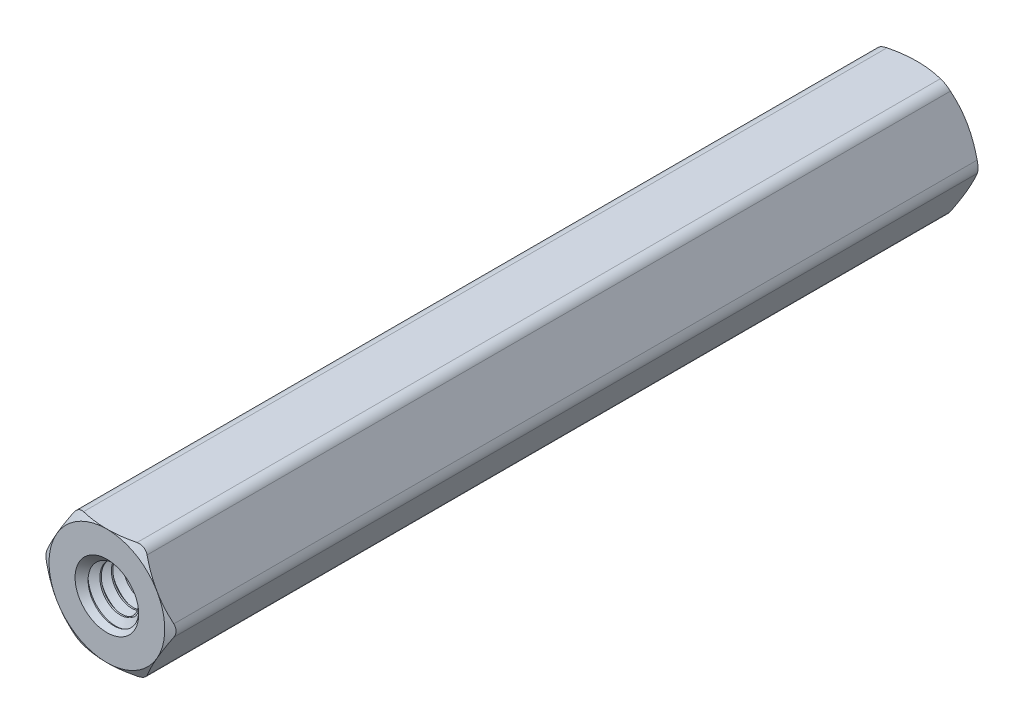
from build123d import *

# Parameters (mm, degrees)
SKETCH4_R           = 4.7625
BOSS_EXTRUDE1_DEPTH = 44.45
SKETCH5_OUTSIDE_W   = 348.112
SKETCH5_OUTSIDE_H   = 346.148
SKETCH5_OUTSIDE_R   = 6.35
CUT_EXTRUDE1_DEPTH  = 90.427601071
CUT_EXTRUDE1_DRAFT  = -60
SKETCH6_OUTSIDE_W   = 348.112
SKETCH6_OUTSIDE_H   = 346.148
SKETCH6_OUTSIDE_R   = 6.35
CUT_EXTRUDE2_DEPTH  = 90.427601071
CUT_EXTRUDE2_DRAFT  = -60
FILLET1_R           = 1.27
BOSS_EXTRUDE2_START = -15.875
SKETCH7_R           = 3.4925
BOSS_EXTRUDE2_DEPTH = 15.875
SKETCH8_W           = 15.875
SKETCH8_H           = 3.175
CUT_SWEEP1_PITCH    = 1.27
CIRPATTERN1_COUNT   = 2


with BuildPart() as part:
    # Sketch3 → Revolve1 (revolve)
    with BuildSketch(Plane(origin=(0, 0, 0), x_dir=(0, 0, -1), z_dir=(1, 0, 0))):
        Polygon((-44.1325, 3.175), (-28.575, 3.175), (-28.575, 0), (28.575, 0), (28.575, 3.175), (44.45, 3.175), (44.45, 6.35), (0, 6.35), (-44.45, 6.35), (-44.45, 3.4925), align=None)
        Polygon((-44.1325, 3.175), (-28.575, 3.175), (-28.575, 0), (28.575, 0), (28.575, 3.175), (44.45, 3.175), (44.45, 6.35), (0, 6.35), (-44.45, 6.35), (-44.45, 3.4925), align=None)
    revolve(axis=Axis((0, 0, 28.575), (0, 0, 1)))

    # Sketch4 → Boss-Extrude1 (add, symmetric)
    with BuildSketch(Plane.XY):
        Polygon((-3.666174209, 6.35), (-7.332348419, 0), (-3.666174209, -6.35), (3.666174209, -6.35), (7.332348419, 0), (3.666174209, 6.35), align=None)
        Circle(SKETCH4_R, mode=Mode.SUBTRACT)
    extrude(amount=BOSS_EXTRUDE1_DEPTH, both=True)


with BuildPart() as cut_extrude1_tool:
    # Sketch5 outside → Cut-Extrude1 (with draft: the straight prism first)
    with BuildSketch(Plane.XY.offset(44.45)):
        Rectangle(SKETCH5_OUTSIDE_W, SKETCH5_OUTSIDE_H)
        Circle(SKETCH5_OUTSIDE_R, mode=Mode.SUBTRACT)
    extrude(amount=-CUT_EXTRUDE1_DEPTH)
    # Cut-Extrude1: the draft: its side faces are tilted about the plane it starts from
    cut_extrude1_sides = [cut_extrude1_tool.faces().sort_by_distance(p)[0] for p in [
        (0, -173.074, -0.763800536),
        (174.056, 0, -0.763800536),
        (0, 173.074, -0.763800536),
        (-174.056, 0, -0.763800536),
        (-6.35, 0, -0.763800536),
    ]]
    draft(cut_extrude1_sides, Plane.XY.offset(44.45), CUT_EXTRUDE1_DRAFT)


with BuildPart() as part_1:
    add(part.part)

    # Cut-Extrude1: cut by cut_extrude1_tool
    add(cut_extrude1_tool.part, mode=Mode.SUBTRACT)


with BuildPart() as cut_extrude2_tool:
    # Sketch6 outside → Cut-Extrude2 (with draft: the straight prism first)
    with BuildSketch(Plane(origin=(0, 0, -44.45), x_dir=(-1, 0, 0), z_dir=(0, 0, -1))):
        Rectangle(SKETCH6_OUTSIDE_W, SKETCH6_OUTSIDE_H)
        Circle(SKETCH6_OUTSIDE_R, mode=Mode.SUBTRACT)
    extrude(amount=-CUT_EXTRUDE2_DEPTH)
    # Cut-Extrude2: the draft: its side faces are tilted about the plane it starts from
    cut_extrude2_sides = [cut_extrude2_tool.faces().sort_by_distance(p)[0] for p in [
        (0, -173.074, 0.763800536),
        (-174.056, 0, 0.763800536),
        (0, 173.074, 0.763800536),
        (174.056, 0, 0.763800536),
        (6.35, 0, 0.763800536),
    ]]
    draft(cut_extrude2_sides, Plane(origin=(0, 0, -44.45), x_dir=(-1, 0, 0), z_dir=(0, 0, -1)), CUT_EXTRUDE2_DRAFT)


with BuildPart() as part_2:
    add(part_1.part)

    # Cut-Extrude2: cut by cut_extrude2_tool
    add(cut_extrude2_tool.part, mode=Mode.SUBTRACT)

    # Fillet1
    fillet1_edges = [part_2.edges().sort_by_distance(p)[0] for p in [
        (3.666174209, 6.35, 0),
        (-7.332348419, 0, 0),
        (-3.666174209, -6.35, 0),
        (3.666174209, -6.35, 0),
        (7.332348419, 0, 0),
        (-3.666174209, 6.35, 0),
    ]]
    fillet(fillet1_edges, radius=FILLET1_R)

    # Split1
    split(bisect_by=Plane.XY, keep=Keep.TOP)

    # Sketch7 → Boss-Extrude2 (add)
    with BuildSketch(Plane(origin=(0, 0, 28.575), x_dir=(-1, 0, 0), z_dir=(0, 0, -1)).offset(BOSS_EXTRUDE2_START)):
        Circle(SKETCH7_R)
    extrude(amount=BOSS_EXTRUDE2_DEPTH)


with BuildPart() as body_2:
    # Sketch8 → Revolve2 (revolve)
    with BuildSketch(Plane(origin=(0, 0, 0), x_dir=(0, 0, -1), z_dir=(1, 0, 0))):
        with Locations((-36.5125, 1.5875)):
            Rectangle(SKETCH8_W, SKETCH8_H)
    revolve(axis=Axis((0, 0, 28.575), (0, 0, 1)))

    # Cut-Sweep1: the profile of Sketch10 screwed along a right-hand helix of 13.5 turns, 8 arcs to a turn; built about Z, then put on its axis
    cut_sweep1_z = Axis((0, 0, 0), (0, 0, 1))
    cut_sweep1_corners = [(2.350110803, 0, -0.635), (2.350110803, 0, -0.47625), (3.243740766, 0, 0.0396875), (3.243740766, 0, -1.1509375)]
    with BuildLine(mode=Mode.PRIVATE) as cut_sweep1_profile:
        Line(cut_sweep1_corners[0], cut_sweep1_corners[1])
        Line(cut_sweep1_corners[1], cut_sweep1_corners[2])
        Line(cut_sweep1_corners[2], cut_sweep1_corners[3])
        Line(cut_sweep1_corners[3], cut_sweep1_corners[0])
    cut_sweep1_cap = Face(cut_sweep1_profile.wire())
    cut_sweep1_turn_angles = [0, 22.5, 45, 67.5, 90, 112.5, 135, 157.5, 180, 202.5, 225, 247.5, 270, 292.5, 315, 337.5, 360]
    cut_sweep1_turn_weights = [1, 0.9238795325112867, 1, 0.9238795325112867, 1, 0.9238795325112867, 1, 0.9238795325112867, 1, 0.9238795325112867, 1, 0.9238795325112867, 1, 0.9238795325112867, 1, 0.9238795325112867, 1]
    cut_sweep1_turn_rails = [Edge.make_bspline([Vector(p[0], p[1], 0).rotate(cut_sweep1_z, cut_sweep1_turn_angles[k]) / cut_sweep1_turn_weights[k] + Vector(0, 0, p[2] + CUT_SWEEP1_PITCH * cut_sweep1_turn_angles[k] / 360) for k in range(17)], [0, 0, 0, 1, 1, 2, 2, 3, 3, 4, 4, 5, 5, 6, 6, 7, 7, 8, 8, 8], 2, cut_sweep1_turn_weights) for p in cut_sweep1_corners]
    cut_sweep1_turn_sides = [Face.make_surface_from_curves(cut_sweep1_turn_rails[p[0]], cut_sweep1_turn_rails[p[1]]) for p in [(0, 1), (1, 2), (2, 3), (3, 0)]]
    cut_sweep1_last_angles = [4680, 4702.5, 4725, 4747.5, 4770, 4792.5, 4815, 4837.5, 4860]
    cut_sweep1_last_weights = [1, 0.9238795325112867, 1, 0.9238795325112867, 1, 0.9238795325112867, 1, 0.9238795325112078, 1]
    cut_sweep1_last_rails = [Edge.make_bspline([Vector(p[0], p[1], 0).rotate(cut_sweep1_z, cut_sweep1_last_angles[k]) / cut_sweep1_last_weights[k] + Vector(0, 0, p[2] + CUT_SWEEP1_PITCH * cut_sweep1_last_angles[k] / 360) for k in range(9)], [0, 0, 0, 1, 1, 2, 2, 3, 3, 4, 4, 4], 2, cut_sweep1_last_weights) for p in cut_sweep1_corners]
    cut_sweep1_last_sides = [Face.make_surface_from_curves(cut_sweep1_last_rails[p[0]], cut_sweep1_last_rails[p[1]]) for p in [(0, 1), (1, 2), (2, 3), (3, 0)]]
    cut_sweep1 = Plane(origin=(0, 0, 44.45), x_dir=(0, 1, 0), z_dir=(0, 0, -1)) * Solid(Shell([*[p.moved(Location((0, 0, CUT_SWEEP1_PITCH * i))) for i in range(13) for p in cut_sweep1_turn_sides], *cut_sweep1_last_sides, cut_sweep1_cap, cut_sweep1_cap.rotate(cut_sweep1_z, 4860).moved(Location((0, 0, CUT_SWEEP1_PITCH * 4860 / 360)))]))
    add(cut_sweep1, mode=Mode.SUBTRACT)


with BuildPart() as part_3:
    add(part_2.part)

    # Combine1: cut body 2
    add(body_2.part, mode=Mode.SUBTRACT)

    # Cut-Extrude3 cone 1 section (through the dimple's axis) → Cut-Extrude3 (revolve, cut)
    with BuildSketch(Plane(origin=(0, 0, 44.45), x_dir=(0, -1, 0), z_dir=(1, 0, 0))):
        Polygon((0, 0), (3.4925, 0), (0, 3.4925), align=None)
    revolve(axis=Axis((0, 0, 44.45), (0, 0, -1)), mode=Mode.SUBTRACT)


with BuildPart() as cirpattern1_1:
    # CirPattern1: pattern copy
    add(part_3.part.rotate(Axis((0, 0, 0), (1, 0, 0)), 1 * 360 / CIRPATTERN1_COUNT))


with BuildPart() as part_4:
    add(part_3.part)

    # Combine2: union CirPattern1_1
    add(cirpattern1_1.part)


solid = part_4.part
